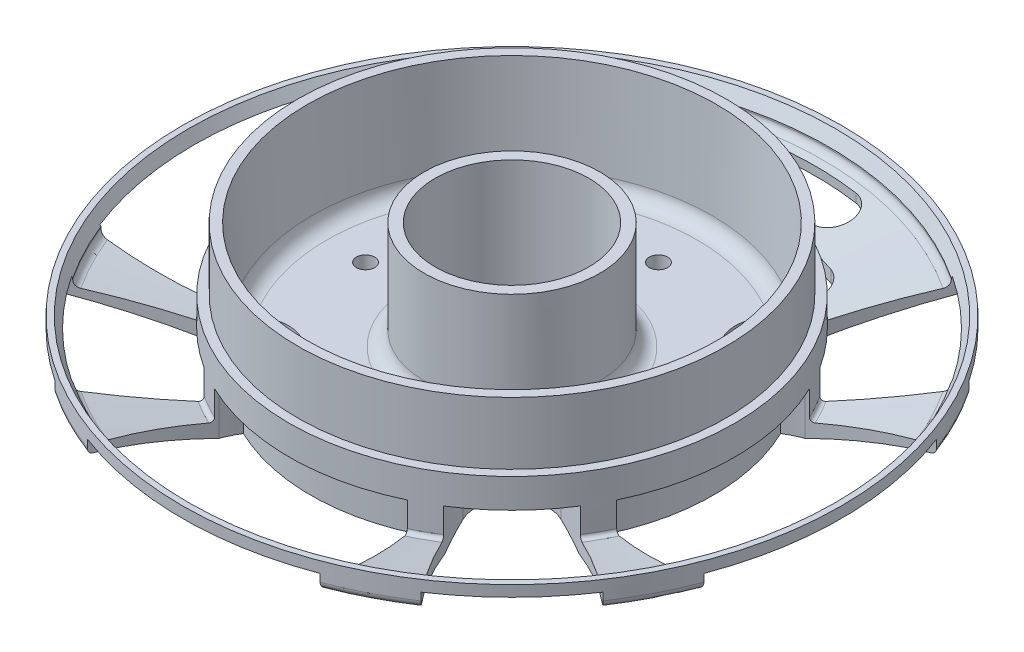
from build123d import *

# Parameters (mm, degrees)
FILLET1_R                   = 1
FILLET2_R                   = 0.5
FILLET3_R                   = 2
CUT_EXTRUDE1_START          = -6
CUT_EXTRUDE1_DEPTH          = 6
CUT_EXTRUDE2_START          = -6
CUT_EXTRUDE2_DEPTH          = 6
FILLET4_R                   = 3
TAP_DRILL_FOR_M3X0_5_TAP1_D = 2.5


with BuildPart() as part:
    # Sketch1 → Revolve1 (revolve)
    with BuildSketch(Plane.XY):
        Polygon((10.5, -26.5), (30, -26.5), (45, -22.3), (45, -19), (44.2, -19), (43.3, -20.7), (43.3, -21.7), (30.45, -24.5), (30.45, -16.5), (29.25, -16.5), (29.25, -8), (27.95, -8), (27.2, -22.7), (12, -22.7), (12, -8), (10.5, -8), align=None)
    revolve(axis=Axis((0, 0, 0), (0, -1, 0)))

    # Fillet1
    fillet1_edges = [part.edges().sort_by_distance(p)[0] for p in [
        (-43.3, -21.7, 0),
        (-45, -22.3, 0),
    ]]
    fillet(fillet1_edges, radius=FILLET1_R)

    # Fillet2
    fillet2_edges = [part.edges().sort_by_distance(p)[0] for p in [
        (-30.45, -24.5, 0),
    ]]
    fillet(fillet2_edges, radius=FILLET2_R)

    # Fillet3
    fillet3_edges = [part.edges().sort_by_distance(p)[0] for p in [
        (-12, -22.7, 0),
        (-27.2, -22.7, 0),
    ]]
    fillet(fillet3_edges, radius=FILLET3_R)

    # Sketch2 → Cut-Extrude1 (cut)
    with BuildSketch(Plane.XZ.offset(26.5).offset(CUT_EXTRUDE1_START)):
        with BuildLine():
            ThreePointArc((-15.9, 42.097387092), (-15.114534477, 34.439237764), (-13, 27.037011669))
            ThreePointArc((-13, 27.037011669), (-12.499814456, 25.890022302), (-11.89867329, 24.792570943))
            ThreePointArc((-11.89867329, 24.792570943), (0, 27.5), (11.89867329, 24.792570943))
            ThreePointArc((11.89867329, 24.792570943), (12.499814456, 25.890022302), (13, 27.037011669))
            ThreePointArc((13, 27.037011669), (15.114534477, 34.439237764), (15.9, 42.097387092))
            ThreePointArc((15.9, 42.097387092), (0, 45), (-15.9, 42.097387092))
        make_face()
        with BuildLine():
            ThreePointArc((42.097387092, 15.9), (34.439237764, 15.114534477), (27.037011669, 13))
            ThreePointArc((27.037011669, 13), (25.890022302, 12.499814456), (24.792570943, 11.89867329))
            ThreePointArc((24.792570943, 11.89867329), (27.5, 0), (24.792570943, -11.89867329))
            ThreePointArc((24.792570943, -11.89867329), (25.890022302, -12.499814456), (27.037011669, -13))
            ThreePointArc((27.037011669, -13), (34.439237764, -15.114534477), (42.097387092, -15.9))
            ThreePointArc((42.097387092, -15.9), (45, 0), (42.097387092, 15.9))
        make_face()
        with BuildLine():
            ThreePointArc((14.268352507, -30.861207311), (13.678185401, -28.934513189), (13, -27.037011669))
            ThreePointArc((13, -27.037011669), (12.499814456, -25.890022302), (11.89867329, -24.792570943))
            ThreePointArc((11.89867329, -24.792570943), (0, -27.5), (-11.89867329, -24.792570943))
            ThreePointArc((-11.89867329, -24.792570943), (-12.499814456, -25.890022302), (-13, -27.037011669))
            ThreePointArc((-13, -27.037011669), (-13.678185401, -28.934513189), (-14.268352507, -30.861207311))
            ThreePointArc((-14.268352507, -30.861207311), (0, -34), (14.268352507, -30.861207311))
        make_face()
        with BuildLine():
            ThreePointArc((-42.097387092, -15.9), (-34.439237764, -15.114534477), (-27.037011669, -13))
            ThreePointArc((-27.037011669, -13), (-25.890022302, -12.499814456), (-24.792570943, -11.89867329))
            ThreePointArc((-24.792570943, -11.89867329), (-27.5, 0), (-24.792570943, 11.89867329))
            ThreePointArc((-24.792570943, 11.89867329), (-25.890022302, 12.499814456), (-27.037011669, 13))
            ThreePointArc((-27.037011669, 13), (-34.439237764, 15.114534477), (-42.097387092, 15.9))
            ThreePointArc((-42.097387092, 15.9), (-45, 0), (-42.097387092, -15.9))
        make_face()
        with BuildLine():
            ThreePointArc((5.109677419, -35.635532782), (0, -36), (-5.109677419, -35.635532782))
            ThreePointArc((-5.109677419, -35.635532782), (-8.222158754, -37.967368956), (-5.890322581, -41.079850291))
            ThreePointArc((-5.890322581, -41.079850291), (0, -41.5), (5.890322581, -41.079850291))
            ThreePointArc((5.890322581, -41.079850291), (8.222158754, -37.967368956), (5.109677419, -35.635532782))
        make_face()
    extrude(amount=CUT_EXTRUDE1_DEPTH, mode=Mode.SUBTRACT)

    # Sketch3 → Cut-Extrude2 (cut)
    with BuildSketch(Plane.XZ.offset(26.5).offset(CUT_EXTRUDE2_START)):
        with BuildLine():
            ThreePointArc((13.242442522, 19.915527081), (14.212846302, 14.212846302), (19.915527081, 13.242442522))
            ThreePointArc((19.915527081, 13.242442522), (29.090108632, 18.488649394), (37.427987917, 24.982908568))
            ThreePointArc((37.427987917, 24.982908568), (31.819805153, 31.819805153), (24.982908568, 37.427987917))
            ThreePointArc((24.982908568, 37.427987917), (18.488649394, 29.090108632), (13.242442522, 19.915527081))
        make_face()
        with BuildLine():
            ThreePointArc((19.915527081, -13.242442522), (14.212846302, -14.212846302), (13.242442522, -19.915527081))
            ThreePointArc((13.242442522, -19.915527081), (18.488649394, -29.090108632), (24.982908568, -37.427987917))
            ThreePointArc((24.982908568, -37.427987917), (31.819805153, -31.819805153), (37.427987917, -24.982908568))
            ThreePointArc((37.427987917, -24.982908568), (29.090108632, -18.488649394), (19.915527081, -13.242442522))
        make_face()
        with BuildLine():
            ThreePointArc((-13.242442522, -19.915527081), (-14.212846302, -14.212846302), (-19.915527081, -13.242442522))
            ThreePointArc((-19.915527081, -13.242442522), (-29.090108632, -18.488649394), (-37.427987917, -24.982908568))
            ThreePointArc((-37.427987917, -24.982908568), (-31.819805153, -31.819805153), (-24.982908568, -37.427987917))
            ThreePointArc((-24.982908568, -37.427987917), (-18.488649394, -29.090108632), (-13.242442522, -19.915527081))
        make_face()
        with BuildLine():
            ThreePointArc((-19.915527081, 13.242442522), (-14.212846302, 14.212846302), (-13.242442522, 19.915527081))
            ThreePointArc((-13.242442522, 19.915527081), (-18.488649394, 29.090108632), (-24.982908568, 37.427987917))
            ThreePointArc((-24.982908568, 37.427987917), (-31.819805153, 31.819805153), (-37.427987917, 24.982908568))
            ThreePointArc((-37.427987917, 24.982908568), (-29.090108632, 18.488649394), (-19.915527081, 13.242442522))
        make_face()
    extrude(amount=CUT_EXTRUDE2_DEPTH, mode=Mode.SUBTRACT)

    # Fillet4
    fillet4_edges = [part.edges().sort_by_distance(p)[0] for p in [
        (-14.268352507, -24.553229572, -30.861207311),
        (14.268352507, -24.553229572, -30.861207311),
    ]]
    fillet(fillet4_edges, radius=FILLET4_R)

    # Tap Drill for M3x0.5 Tap1 (through all)
    with Locations(Plane(origin=(0, -26.5, 0), x_dir=(-1, 0, 0), z_dir=(0, -1, 0))):
        with Locations((0, 20), (20, 0), (0, -20), (-20, 0)):
            Hole(TAP_DRILL_FOR_M3X0_5_TAP1_D / 2)


solid = part.part
